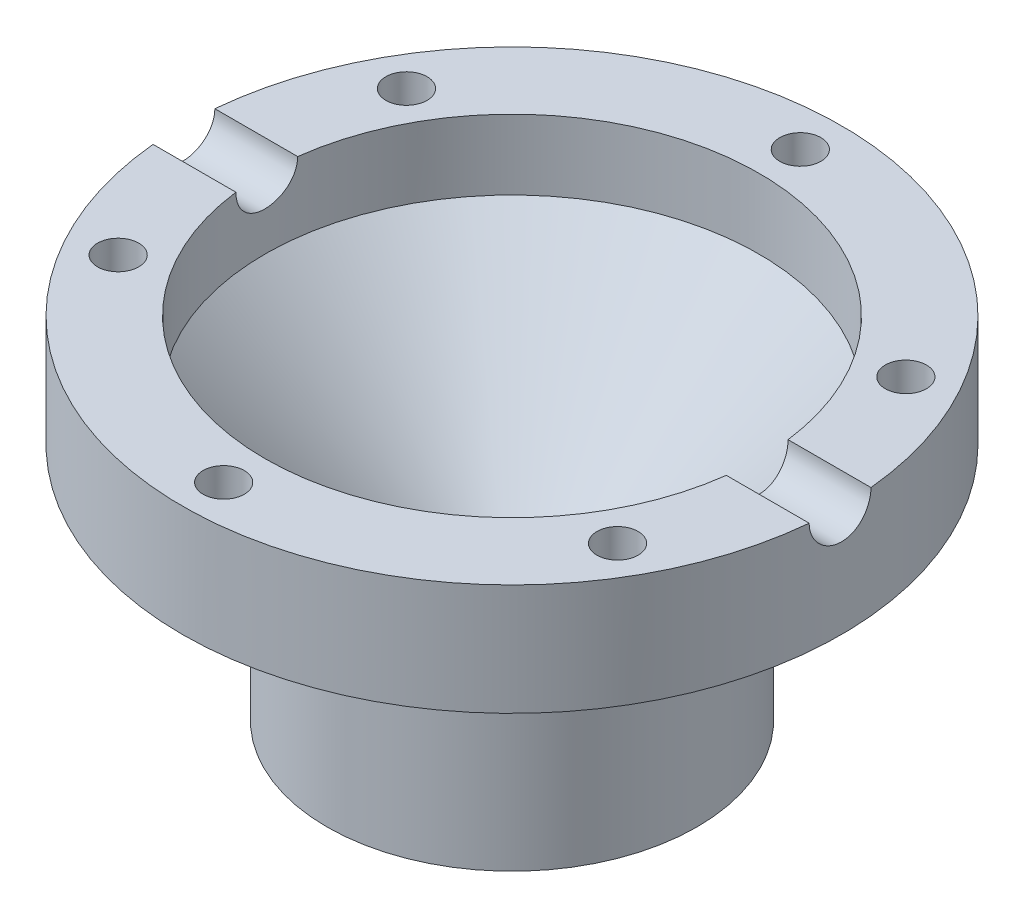
from build123d import *

# Parameters (mm, degrees)
SKETCH1_R           = 20.32
BOSS_EXTRUDE1_DEPTH = 21.59
SKETCH2_W           = 15.24
SKETCH2_H           = 4.318
SKETCH3_W           = 5.08
SKETCH3_H           = 14.732
CUT_EXTRUDE1_REACH  = 37.943
SKETCH4_R           = 1.27
CIRPATTERN1_COUNT   = 6
CUT_EXTRUDE2_REACH  = 37.943
SKETCH5_R           = 4.699
SKETCH9_R           = 1.905
CUT_EXTRUDE3_DEPTH  = 51.305467894


with BuildPart() as part:
    # Sketch1 → Boss-Extrude1 (new body)
    with BuildSketch(Plane(origin=(0, 0, 0), x_dir=(1, 0, 0), z_dir=(0, 1, 0))):
        Circle(SKETCH1_R)
    extrude(amount=BOSS_EXTRUDE1_DEPTH)

    # Sketch2 → Cut-Revolve1 (revolve, cut)
    with BuildSketch(Plane.XY):
        with Locations((-7.62, 19.431)):
            Rectangle(SKETCH2_W, SKETCH2_H)
    revolve(axis=Axis((0, 55, 0), (0, -1, 0)), mode=Mode.SUBTRACT)

    # Sketch3 → Cut-Revolve2 (revolve, cut)
    with BuildSketch(Plane.XY):
        with Locations((-17.78, 7.366)):
            Rectangle(SKETCH3_W, SKETCH3_H)
    revolve(axis=Axis((0, 55, 0), (0, -1, 0)), mode=Mode.SUBTRACT)

    # Sketch4 → Cut-Extrude1 (cut, up to next)
    with BuildSketch(Plane(origin=(0, 21.59, 0), x_dir=(1, 0, 0), z_dir=(0, 1, 0)), mode=Mode.PRIVATE) as cut_extrude1_sk1:
        with Locations((0, 17.78)):
            Circle(SKETCH4_R)
    cut_extrude1_tool1 = extrude(cut_extrude1_sk1.sketch, amount=-CUT_EXTRUDE1_REACH, mode=Mode.PRIVATE) & part.part
    cut_extrude1 = cut_extrude1_tool1.solids().sort_by_distance((0, 21.59, -17.78))[0]
    add(cut_extrude1, mode=Mode.SUBTRACT)

    # CirPattern1: Cut-Extrude1 ×6 about axis
    cirpattern1_axis = Axis((0, 55, 0), (0, -1, 0))
    for i in range(1, CIRPATTERN1_COUNT):
        add(cut_extrude1.rotate(cirpattern1_axis, i * 360 / CIRPATTERN1_COUNT), mode=Mode.SUBTRACT)

    # Sketch5 → Cut-Extrude2 (cut, up to next)
    with BuildSketch(Plane.XZ, mode=Mode.PRIVATE) as cut_extrude2_sk1:
        Circle(SKETCH5_R)
    cut_extrude2_tool1 = extrude(cut_extrude2_sk1.sketch, amount=-CUT_EXTRUDE2_REACH, mode=Mode.PRIVATE) & part.part
    add(cut_extrude2_tool1.solids().sort_by_distance((0, 0, 0))[0], mode=Mode.SUBTRACT)

    # Sketch7 → Cut-Revolve3 (revolve, cut)
    with BuildSketch(Plane.XY):
        Polygon((-15.24, 14.732), (-11.40968, 10.90168), (-11.40968, 0), (-15.24, 0), align=None)
    revolve(axis=Axis((0, 55, 0), (0, -1, 0)), mode=Mode.SUBTRACT)

    # Sketch8 → Cut-Revolve4 (revolve, cut)
    with BuildSketch(Plane.XY):
        Polygon((-4.699, 17.272), (-15.24, 17.272), (-4.699, 6.731), align=None)
    revolve(axis=Axis((0, 55, 0), (0, -1, 0)), mode=Mode.SUBTRACT)

    # Sketch9 → Cut-Extrude3 (cut, through all)
    with BuildSketch(Plane(origin=(20.32, 0, 0), x_dir=(0, 0, -1), z_dir=(1, 0, 0))):
        with Locations((0, 21.59)):
            Circle(SKETCH9_R)
    extrude(amount=-CUT_EXTRUDE3_DEPTH, mode=Mode.SUBTRACT)


solid = part.part
